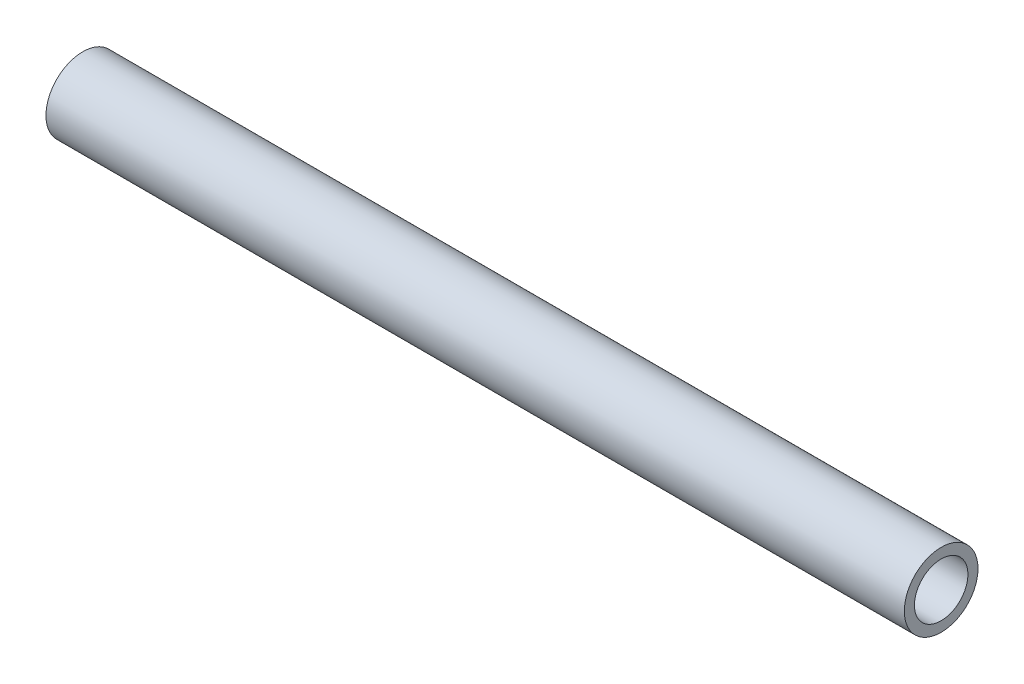
from build123d import *

# Parameters (mm, degrees)
SKETCH1_R           = 13.15
SKETCH1_R_2         = 9.55
BOSS_EXTRUDE1_DEPTH = 306.4


with BuildPart() as part:
    # Sketch1 → Boss-Extrude1 (new body)
    with BuildSketch(Plane(origin=(0, 0, 0), x_dir=(0, 0, -1), z_dir=(1, 0, 0))):
        Circle(SKETCH1_R)
        Circle(SKETCH1_R_2, mode=Mode.SUBTRACT)
    extrude(amount=BOSS_EXTRUDE1_DEPTH)


solid = part.part
